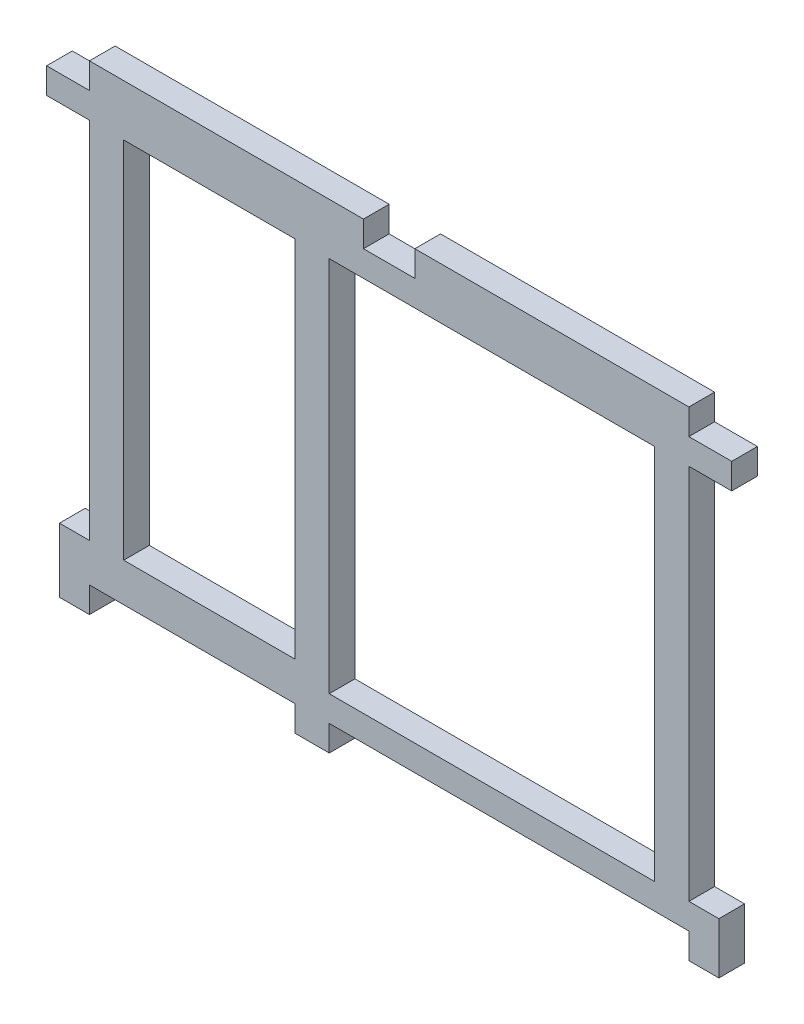
from build123d import *

# Parameters (mm, degrees)
SKETCH1_W           = 20
SKETCH1_H           = 42.5
SKETCH1_W_2         = 38
SKETCH1_H_2         = 44
BOSS_EXTRUDE1_DEPTH = 3


with BuildPart() as part:
    # Sketch1 → Boss-Extrude1 (new body)
    with BuildSketch(Plane.XY):
        Polygon((5, -3), (0, -3), (0, 0), (5, 0), (5, 3), (37, 3), (37, 0), (43, 0), (43, 3), (75, 3), (75, 0), (80, 0), (80, -3), (75, -3), (75, -47), (78.5, -47), (78.5, -53), (75, -53), (75, -50), (33, -50), (33, -53), (29, -53), (29, -50), (5, -50), (5, -53), (1.5, -53), (1.5, -45.5), (5, -45.5), align=None)
        with Locations((19, -24.25)):
            Rectangle(SKETCH1_W, SKETCH1_H, mode=Mode.SUBTRACT)
        with Locations((52, -25)):
            Rectangle(SKETCH1_W_2, SKETCH1_H_2, mode=Mode.SUBTRACT)
    extrude(amount=BOSS_EXTRUDE1_DEPTH)


solid = part.part
